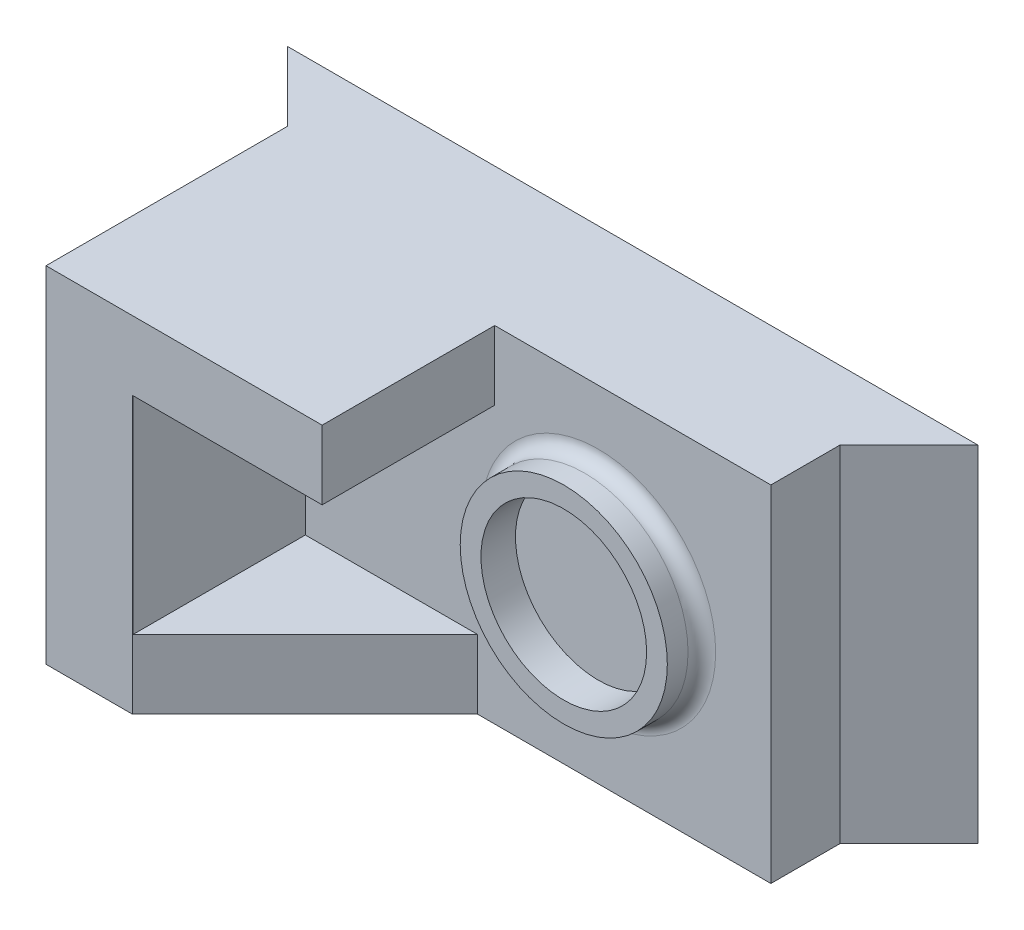
from build123d import *

# Parameters (mm, degrees)
SKETCH1_W           = 100
SKETCH1_H           = 50
BOSS_EXTRUDE2_DEPTH = 10
SKETCH3_W           = 80
SKETCH3_H           = 50
BOSS_EXTRUDE3_DEPTH = 10
SKETCH4_W           = 40
SKETCH4_H           = 50
BOSS_EXTRUDE4_DEPTH = 25
SKETCH5_W           = 60
SKETCH5_H           = 30
CUT_EXTRUDE1_DEPTH  = 25
SKETCH6_R           = 15
SKETCH6_R_2         = 12
BOSS_EXTRUDE5_DEPTH = 5
CHAMFER2_SIZE       = 10
CHAMFER3_SIZE       = 10
FILLET3_R           = 2
CHAMFER6_SIZE       = 27.5


# Some blends are built 0.0001 mm under size
with BuildPart() as part:
    # Sketch1 → Boss-Extrude2 (new body)
    with BuildSketch(Plane.XY):
        Rectangle(SKETCH1_W, SKETCH1_H)
    extrude(amount=BOSS_EXTRUDE2_DEPTH)

    # Sketch3 → Boss-Extrude3 (add)
    with BuildSketch(Plane.XY.offset(10)):
        Rectangle(SKETCH3_W, SKETCH3_H)
    extrude(amount=BOSS_EXTRUDE3_DEPTH)

    # Sketch4 → Boss-Extrude4 (add)
    with BuildSketch(Plane.XY.offset(20)):
        with Locations((-20, 0)):
            Rectangle(SKETCH4_W, SKETCH4_H)
    extrude(amount=BOSS_EXTRUDE4_DEPTH)

    # Sketch5 → Cut-Extrude1 (cut)
    with BuildSketch(Plane.XY.offset(45)):
        with Locations((2.565042783, 0)):
            Rectangle(SKETCH5_W, SKETCH5_H)
    extrude(amount=-CUT_EXTRUDE1_DEPTH, mode=Mode.SUBTRACT)

    # Sketch6 → Boss-Extrude5 (add)
    with BuildSketch(Plane.XY.offset(20)):
        with Locations((15, 0)):
            Circle(SKETCH6_R)
        with Locations((15, 0)):
            Circle(SKETCH6_R_2, mode=Mode.SUBTRACT)
    extrude(amount=BOSS_EXTRUDE5_DEPTH)

    # Chamfer2
    chamfer2_edges = [part.edges().sort_by_distance(p)[0] for p in [
        (50, 0, 10),
    ]]
    chamfer(chamfer2_edges, length=CHAMFER2_SIZE - 0.0001)  # a hair under: the kernel refuses the full size

    # Chamfer3
    chamfer3_edges = [part.edges().sort_by_distance(p)[0] for p in [
        (-50, 0, 10),
    ]]
    chamfer(chamfer3_edges, length=CHAMFER3_SIZE - 0.0001)  # a hair under: the kernel refuses the full size

    # Fillet3
    fillet3_edges = [part.edges().sort_by_distance(p)[0] for p in [
        (0, 0, 20),
    ]]
    fillet(fillet3_edges, radius=FILLET3_R)

    # Chamfer6
    # the kernel refuses this chamfer: 27.5 mm, written as the material it takes off along each edge
    with BuildSketch(Plane(origin=(0, -15, 45), x_dir=(0.027495876610586376, 0, -0.9996219169112968), z_dir=(0, -1, 0))) as chamfer6_piece_1_section:
        Polygon((CHAMFER6_SIZE * 0.999621916911, -CHAMFER6_SIZE * 0.0274958766106), (-CHAMFER6_SIZE * 0.0274958766106, -CHAMFER6_SIZE * 0.999621916911), (0, 0), align=None)
    chamfer6_piece_1 = extrude(amount=80.721282169, mode=Mode.PRIVATE)
    chamfer6_piece_1 = split(chamfer6_piece_1, bisect_by=Plane(origin=(-2.708333333, -20, 20), z_dir=(0, 0, 1)), keep=Keep.TOP, mode=Mode.PRIVATE)
    add(chamfer6_piece_1, mode=Mode.SUBTRACT)
    with BuildSketch(Plane(origin=(0, 55.721282169, 45), x_dir=(0.027495876610586376, 0, -0.9996219169112968), z_dir=(0, -1, 0))) as chamfer6_piece_2_section:
        Polygon((CHAMFER6_SIZE * 0.999621916911, -CHAMFER6_SIZE * 0.0274958766106), (-CHAMFER6_SIZE * 0.0274958766106, -CHAMFER6_SIZE * 0.999621916911), (0, 0), align=None)
    chamfer6_piece_2 = extrude(amount=151.442564338, mode=Mode.PRIVATE)
    chamfer6_piece_2 = split(chamfer6_piece_2, bisect_by=Plane(origin=(-27.456638145, 15, 44.978319072), z_dir=(0, -1, 0)), keep=Keep.TOP, mode=Mode.PRIVATE)
    chamfer6_piece_2 = split(chamfer6_piece_2, bisect_by=Plane(origin=(-27.456638145, 0, 25), z_dir=(0, 0, 1)), keep=Keep.TOP, mode=Mode.PRIVATE)
    add(chamfer6_piece_2, mode=Mode.SUBTRACT)


solid = part.part
